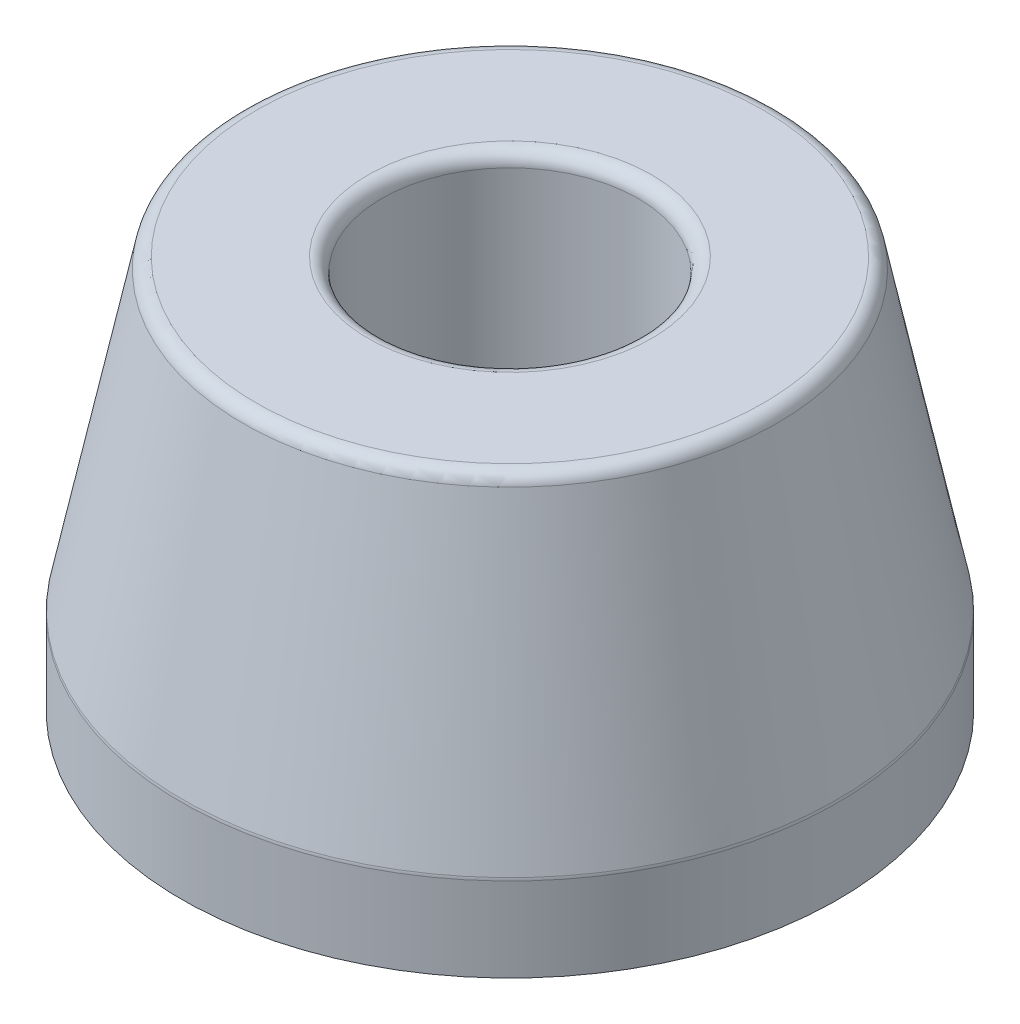
from build123d import *


with BuildPart() as part:
    # Sketch1 → Revolve1 (revolve)
    with BuildSketch(Plane.XY):
        with BuildLine():
            Line((4.7625, 0), (4.7625, 14.097))
            ThreePointArc((4.7625, 14.097), (4.911289755, 14.456210245), (5.2705, 14.605))
            Line((5.2705, 14.605), (9.428300973, 14.605))
            ThreePointArc((9.428300973, 14.605), (9.749318022, 14.490715702), (9.925897244, 14.199283678))
            Line((9.925897244, 14.199283678), (12.181596271, 3.225612734))
            ThreePointArc((12.181596271, 3.225612734), (12.189392375, 3.174734767), (12.192, 3.123329056))
            Line((12.192, 3.123329056), (12.192, 0))
            Line((12.192, 0), (4.7625, 0))
        make_face()
    revolve(axis=Axis((0, 0, 0), (0, 1, 0)))


solid = part.part
